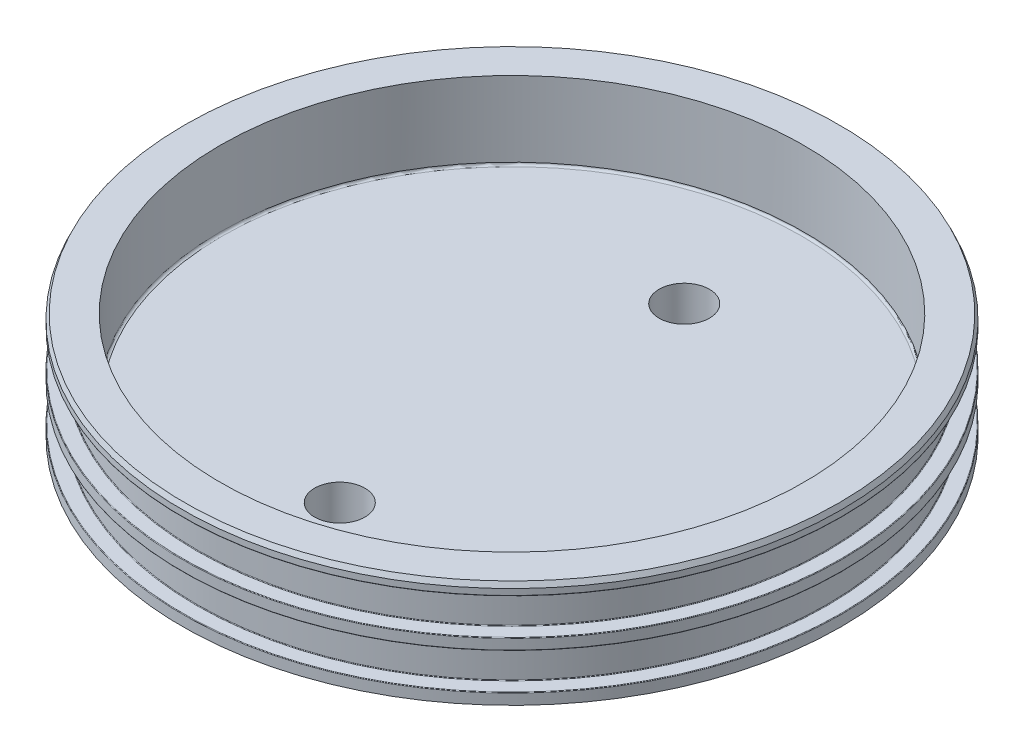
from build123d import *

# Parameters (mm, degrees)
SKETCH6_R                                = 66.04
BOSS_EXTRUDE1_DEPTH                      = 2.54
PIPE_TAP_DRILL_FOR_1_4_TAP_GN2_D         = 11.1252
CNC_ID_FILLET_R                          = 0.127
CNC_OD_FILLET_R                          = 0.127
CNC_CHAMFERS_SIZE                        = 0.508
CNC_CHAMFERS_SIZE2                       = 1.089409516
CNC_BORE_FILLET_R                        = 0.508
PIPE_TAP_DRILL_FOR_1_4_TAP_RELIEF_VALV_D = 11.1252


with BuildPart() as part:
    # Sketch1 → Revolve1 (revolve)
    with BuildSketch(Plane.XY):
        Polygon((0, 0), (72.898, 0), (72.898, 2.4638), (69.6468, 2.4638), (69.6468, 10.4648), (72.898, 10.4648), (72.898, 12.9286), (69.6468, 12.9286), (69.6468, 20.9296), (72.898, 20.9296), (72.898, 23.4696), (64.5668, 23.4696), (64.5668, 6.35), (0, 6.35), align=None)
    revolve(axis=Axis((0, 48.192213231, 0), (0, -1, 0)))

    # Sketch6 → Boss-Extrude1 (add)
    with BuildSketch(Plane.XZ):
        Circle(SKETCH6_R)
    extrude(amount=BOSS_EXTRUDE1_DEPTH)

    # Pipe Tap Drill for 1/4 Tap - GN2 (through all)
    with Locations(Plane(origin=(0, 6.35, 0), x_dir=(1, 0, 0), z_dir=(0, 1, 0))):
        with Locations((0, -38.1)):
            Hole(PIPE_TAP_DRILL_FOR_1_4_TAP_GN2_D / 2)

    # CNC ID Fillet
    cnc_id_fillet_edges = [part.edges().sort_by_distance(p)[0] for p in [
        (-69.6468, 10.4648, 0),
        (-69.6468, 2.4638, 0),
        (-69.6468, 20.9296, 0),
        (-69.6468, 12.9286, 0),
        (-66.04, 0, 0),
    ]]
    fillet(cnc_id_fillet_edges, radius=CNC_ID_FILLET_R)

    # CNC OD Fillet
    cnc_od_fillet_edges = [part.edges().sort_by_distance(p)[0] for p in [
        (-72.898, 10.4648, 0),
        (-72.898, 2.4638, 0),
        (-66.04, -2.54, 0),
        (-72.898, 20.9296, 0),
        (-72.898, 12.9286, 0),
    ]]
    fillet(cnc_od_fillet_edges, radius=CNC_OD_FILLET_R)

    # CNC Chamfers
    cnc_chamfers_edges = [part.edges().sort_by_distance(p)[0] for p in [
        (-72.898, 23.4696, 0),
    ]]
    cnc_chamfers_side = [part.faces().sort_by_distance(p)[0] for p in [
        (-70.836133195, 23.4696, 0),
    ]]
    chamfer(cnc_chamfers_edges, length=CNC_CHAMFERS_SIZE, length2=CNC_CHAMFERS_SIZE2, reference=cnc_chamfers_side[0])

    # CNC Bore Fillet
    cnc_bore_fillet_edges = [part.edges().sort_by_distance(p)[0] for p in [
        (-64.5668, 6.35, 0),
    ]]
    fillet(cnc_bore_fillet_edges, radius=CNC_BORE_FILLET_R)

    # Pipe Tap Drill for 1/4 Tap - Relief Valve (through all)
    with Locations(Plane(origin=(0, -2.54, 0), x_dir=(-1, 0, 0), z_dir=(0, -1, 0))):
        with Locations((0, 38.1)):
            Hole(PIPE_TAP_DRILL_FOR_1_4_TAP_RELIEF_VALV_D / 2)


solid = part.part
